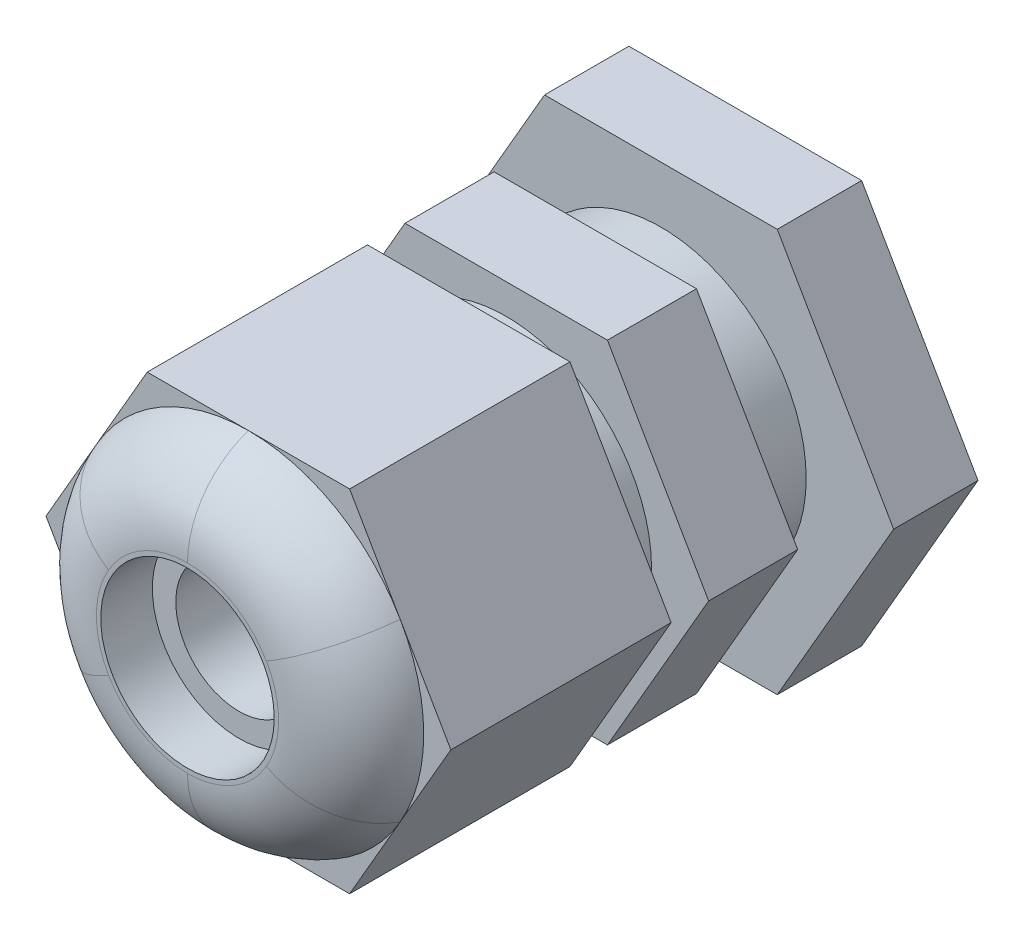
from build123d import *

# Parameters (mm, degrees)
BOSS_EXTRUDE1_DEPTH = 11.75
SKETCH2_R           = 7.75
BOSS_EXTRUDE2_DEPTH = 2
BOSS_EXTRUDE3_DEPTH = 4.75
SKETCH4_R           = 7.75
BOSS_EXTRUDE4_DEPTH = 3.5
BOSS_EXTRUDE5_DEPTH = 4.5
SKETCH6_R           = 7.75
BOSS_EXTRUDE6_DEPTH = 1.25
SKETCH7_R           = 5.75
CUT_EXTRUDE1_DEPTH  = 20
SKETCH8_R           = 9.35
BOSS_EXTRUDE7_DEPTH = 3.25
SKETCH9_R           = 4.625
CUT_EXTRUDE2_DEPTH  = 2.75
FILLET2_R           = 4.725
SKETCH10_R          = 3.375
CUT_EXTRUDE3_DEPTH  = 33.675806544


with BuildPart() as part:
    # Sketch1 → Boss-Extrude1 (new body)
    with BuildSketch(Plane.XY):
        Polygon((10.796450034, 0), (5.398225017, 9.35), (-5.398225017, 9.35), (-10.796450034, 0), (-5.398225017, -9.35), (5.398225017, -9.35), align=None)
    extrude(amount=BOSS_EXTRUDE1_DEPTH)

    # Sketch2 → Boss-Extrude2 (add)
    with BuildSketch(Plane(origin=(0, 0, 0), x_dir=(-1, 0, 0), z_dir=(0, 0, -1))):
        Circle(SKETCH2_R)
    extrude(amount=BOSS_EXTRUDE2_DEPTH)

    # Sketch3 → Boss-Extrude3 (add)
    with BuildSketch(Plane(origin=(0, 0, -2), x_dir=(-1, 0, 0), z_dir=(0, 0, -1))):
        Polygon((10.796450034, 0), (5.398225017, 9.35), (-5.398225017, 9.35), (-10.796450034, 0), (-5.398225017, -9.35), (5.398225017, -9.35), align=None)
    extrude(amount=BOSS_EXTRUDE3_DEPTH)

    # Sketch4 → Boss-Extrude4 (add)
    with BuildSketch(Plane(origin=(0, 0, -6.75), x_dir=(-1, 0, 0), z_dir=(0, 0, -1))):
        Circle(SKETCH4_R)
    extrude(amount=BOSS_EXTRUDE4_DEPTH)

    # Sketch5 → Boss-Extrude5 (add)
    with BuildSketch(Plane(origin=(0, 0, -10.25), x_dir=(-1, 0, 0), z_dir=(0, 0, -1))):
        Polygon((12.413030788, 0), (6.206515394, 10.75), (-6.206515394, 10.75), (-12.413030788, 0), (-6.206515394, -10.75), (6.206515394, -10.75), align=None)
    extrude(amount=BOSS_EXTRUDE5_DEPTH)

    # Sketch6 → Boss-Extrude6 (add)
    with BuildSketch(Plane(origin=(0, 0, -14.75), x_dir=(-1, 0, 0), z_dir=(0, 0, -1))):
        Circle(SKETCH6_R)
    extrude(amount=BOSS_EXTRUDE6_DEPTH)

    # Sketch7 → Cut-Extrude1 (cut)
    with BuildSketch(Plane(origin=(0, 0, -16), x_dir=(-1, 0, 0), z_dir=(0, 0, -1))):
        Circle(SKETCH7_R)
    extrude(amount=-CUT_EXTRUDE1_DEPTH, mode=Mode.SUBTRACT)

    # Sketch8 → Boss-Extrude7 (add)
    with BuildSketch(Plane.XY.offset(11.75)):
        with Locations(Location((0, 0, 0), (0, 0, 210))):
            Circle(SKETCH8_R)
    extrude(amount=BOSS_EXTRUDE7_DEPTH)

    # Sketch9 → Cut-Extrude2 (cut)
    with BuildSketch(Plane.XY.offset(15)):
        Circle(SKETCH9_R)
    extrude(amount=-CUT_EXTRUDE2_DEPTH, mode=Mode.SUBTRACT)

    # Fillet2
    # the kernel refuses this fillet: 4.725 mm, written as the material it takes off along each edge
    with BuildSketch(Plane(origin=(0, 0, 15), x_dir=(-0.8660254037844385, -0.5000000000000001, 0), z_dir=(-0.5000000000000001, 0.8660254037844385, 0))) as fillet2_piece_1:
        with BuildLine():
            CenterArc((4.861124863, -4.725), FILLET2_R, 18.190012051, 71.809987949)
            Line((4.861124863, 0), (4.861124863, 0.0945))
            Line((4.861124863, 0.0945), (9.35, 0.0945))
            Line((9.35, 0.0945), (9.4445, 0))
            ThreePointArc((9.4445, 0), (9.4445, -1.625), (9.439777503, -3.2205))
            Line((9.439777503, -3.2205), (9.35, -3.25))
        make_face()
    revolve(axis=Axis((0, 0, 15), (0, 0, 1)), mode=Mode.SUBTRACT)

    # Sketch10 → Cut-Extrude3 (cut, through all)
    with BuildSketch(Plane.XY.offset(12.25)):
        Circle(SKETCH10_R)
    extrude(amount=-CUT_EXTRUDE3_DEPTH, mode=Mode.SUBTRACT)


solid = part.part
